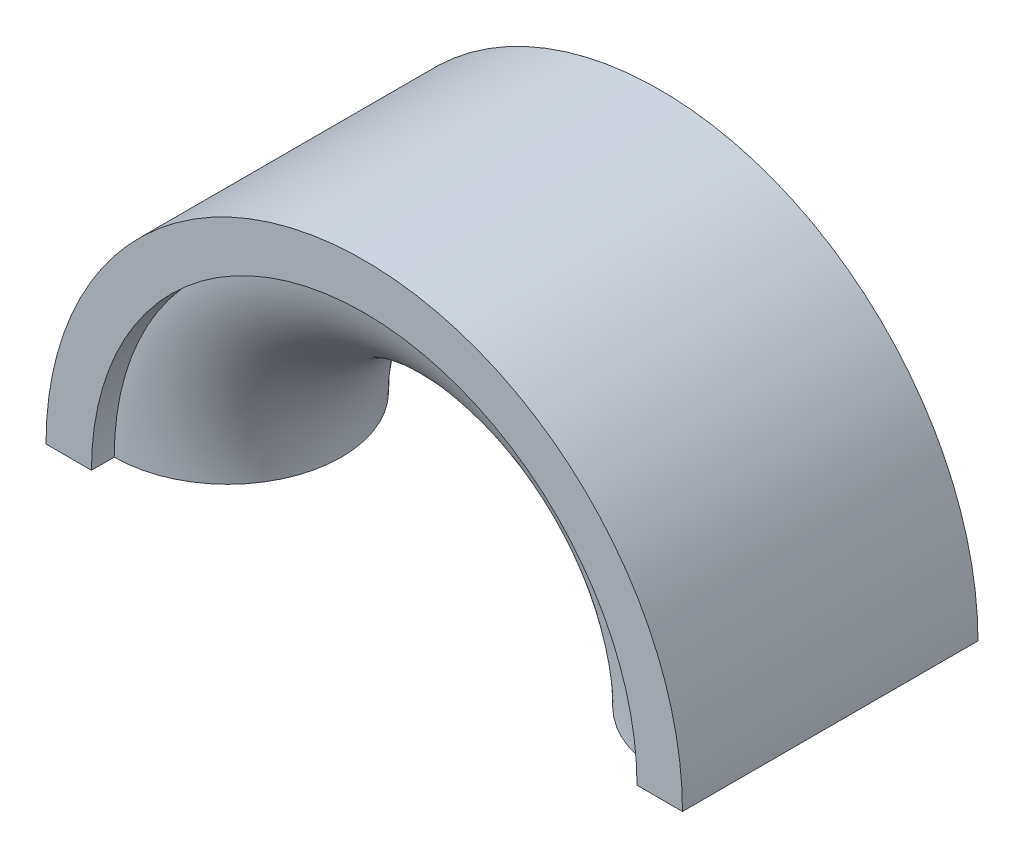
from build123d import *

# Parameters (mm, degrees)
SKETCH_1_R               = 12
EXTRUDE_1_DEPTH          = 12
OTHER_1_2_OUTLINE_R      = 12
OTHER_1_2_OUTLINE_R_2    = 5
OTHER_1_2_DEPTH          = 12
OTHER_1_3_OUTLINE_R      = 5
OTHER_1_3_OUTLINE_R_2    = 4
OTHER_1_3_DEPTH          = 4
OTHER_START              = 8
OTHER_1_4_OUTLINE_R      = 5
OTHER_1_4_OUTLINE_R_2    = 4
OTHER_1_4_DEPTH          = 4
SKETCH_2_R               = 12
EXTRUDE_2_DEPTH          = 1
SKETCH_3_W               = 2
SKETCH_3_H               = 13
SKETCH_4_R               = 1
EXTRUDE_3_DEPTH          = 4
SKETCH_5_W               = 34.262916627
SKETCH_5_H               = 20.154656839
CUT_EXTRUDE_3_DEPTH      = 24.151673806
SKETCH_6_R               = 1.35
CUT_EXTRUDE_4_DEPTH      = 2
CUT_EXTRUDE_5_DEPTH      = 10
CUT_EXTRUDE_5_DEPTH_BACK = 10
SKETCH_7_R               = 4.05


with BuildPart() as part:
    # 草图1 → 凸台-拉伸1 (new body)
    with BuildSketch(Plane.XY):
        Circle(SKETCH_1_R)
    extrude(amount=EXTRUDE_1_DEPTH)

    # Other 1 2 outline → Other 1 2 (cut)
    with BuildSketch(Plane.XY):
        Circle(OTHER_1_2_OUTLINE_R)
        Circle(OTHER_1_2_OUTLINE_R_2, mode=Mode.SUBTRACT)
    extrude(amount=OTHER_1_2_DEPTH, mode=Mode.SUBTRACT)

    # Other 1 3 outline → Other 1 3 (cut)
    with BuildSketch(Plane.XY):
        Circle(OTHER_1_3_OUTLINE_R)
        Circle(OTHER_1_3_OUTLINE_R_2, mode=Mode.SUBTRACT)
    extrude(amount=OTHER_1_3_DEPTH, mode=Mode.SUBTRACT)

    # Other 1 4 outline → Other 1 4 (cut)
    with BuildSketch(Plane.XY.offset(OTHER_START)):
        Circle(OTHER_1_4_OUTLINE_R)
        Circle(OTHER_1_4_OUTLINE_R_2, mode=Mode.SUBTRACT)
    extrude(amount=OTHER_1_4_DEPTH, mode=Mode.SUBTRACT)


with BuildPart() as body_2:
    # 型腔1: read off the stored shape, not the designer's step
    # 型腔1 outline → 型腔1 (revolve)
    with BuildSketch(Plane.XZ):
        with BuildLine():
            Line((12, 1), (12, 11))
            ThreePointArc((12, 11), (7, 6), (12, 1))
        make_face()
    revolve(axis=Axis((0, 0, 0), (0, 0, 1)))



with BuildPart() as body_2_2:
    # 草图2 → 凸台-拉伸2 (new body)
    with BuildSketch(Plane.XY):
        with Locations(Location((0, 0, 0), (0, 0, 270))):
            Circle(SKETCH_2_R)
    extrude(amount=-EXTRUDE_2_DEPTH)


with BuildPart() as body_2_1:
    add(body_2.part)

    add(body_2_2.part)  # 旋转1 merges body 2 2
    # 草图3 → 旋转1 (revolve)
    with BuildSketch(Plane(origin=(0, 0, 0), x_dir=(1, 0, 0), z_dir=(0, 1, 0))):
        with Locations((-13, -5.5)):
            Rectangle(SKETCH_3_W, SKETCH_3_H)
    revolve(axis=Axis((0, 0, 0), (0, 0, 1)))

    # 草图4 → 凸台-拉伸3 (add)
    with BuildSketch(Plane.XY):
        Circle(SKETCH_4_R)
    extrude(amount=EXTRUDE_3_DEPTH)

    # 草图5 → 切除-拉伸3 (cut, through all)
    with BuildSketch(Plane(origin=(0, 0, 0), x_dir=(1, 0, 0), z_dir=(0, 1, 0))):
        with Locations((0.6382308, -6.140467699)):
            Rectangle(SKETCH_5_W, SKETCH_5_H)
    extrude(amount=-CUT_EXTRUDE_3_DEPTH, mode=Mode.SUBTRACT)

    # 草图6 → 切除-拉伸4 (cut)
    with BuildSketch(Plane.XZ):
        with Locations(Location((10, 6, 0), (0, 0, 270))):
            Circle(SKETCH_6_R)
        with Locations(Location((-10, 6, 0), (0, 0, 270))):
            Circle(SKETCH_6_R)
    extrude(amount=-CUT_EXTRUDE_4_DEPTH, mode=Mode.SUBTRACT)

    # 草图7 → 切除-拉伸5 (cut, two sides: drawn at the far end of the back side and taken through both)
    with BuildSketch(Plane.XY.offset(-CUT_EXTRUDE_5_DEPTH_BACK)):
        Circle(SKETCH_7_R)
    extrude(amount=CUT_EXTRUDE_5_DEPTH + CUT_EXTRUDE_5_DEPTH_BACK, mode=Mode.SUBTRACT)


solid = body_2_1.part
